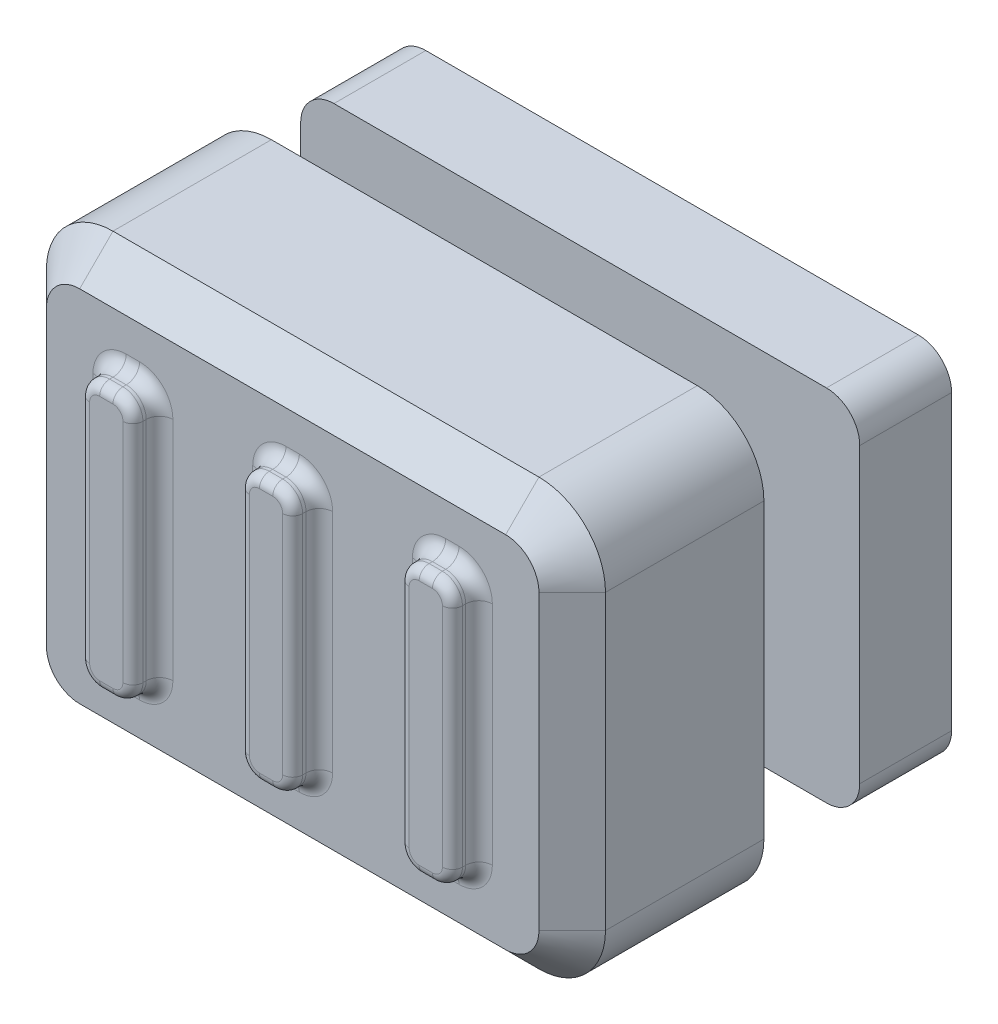
from build123d import *

# Parameters (mm, degrees)
SLIDER_STEM_DEPTH         = 4.2
CAPTIVE_FLANGE_START      = 1.2
CAPTIVE_FLANGE_DEPTH      = 1.38
THUMB_PAD_START           = 4.02
THUMB_PAD_DEPTH           = 2.38
SWITCH_PIN_SOCKET_START   = 2.3
SWITCH_PIN_SOCKET_DEPTH   = 2.4
PCB_EDGE_RELIEF_START     = 0.6
PCB_EDGE_RELIEF_PROFILE_W = 4
PCB_EDGE_RELIEF_PROFILE_H = 1.05
PCB_EDGE_RELIEF_DEPTH     = 0.7
STEM_SHOULDER_ROUND_R     = 0.2
THUMB_RIB_0_START         = 6.8
THUMB_RIB_0_DEPTH         = 0.5
THUMB_RIB_1_START         = 6.8
THUMB_RIB_1_DEPTH         = 0.5
THUMB_RIB_2_START         = 6.8
THUMB_RIB_2_DEPTH         = 0.5
THUMB_RIB_ROOT_ROUND_R    = 0.2
THUMB_RIB_CROWN_ROUND_R   = 0.15


with BuildPart() as part:
    # Slider_stem_profile → Slider_stem (new body)
    with BuildSketch(Plane.XY):
        with BuildLine():
            Line((-1.5, -1.5), (1.5, -1.5))
            ThreePointArc((1.5, -1.5), (1.782842712, -1.382842712), (1.9, -1.1))
            Line((1.9, -1.1), (1.9, 1.1))
            ThreePointArc((1.9, 1.1), (1.782842712, 1.382842712), (1.5, 1.5))
            Line((1.5, 1.5), (-1.5, 1.5))
            ThreePointArc((-1.5, 1.5), (-1.782842712, 1.382842712), (-1.9, 1.1))
            Line((-1.9, 1.1), (-1.9, -1.1))
            ThreePointArc((-1.9, -1.1), (-1.782842712, -1.382842712), (-1.5, -1.5))
        make_face()
    extrude(amount=SLIDER_STEM_DEPTH)

    # Captive_flange_profile → Captive_flange (add)
    with BuildSketch(Plane.XY.offset(CAPTIVE_FLANGE_START)):
        with BuildLine():
            Line((-3.7, -2.7), (3.7, -2.7))
            ThreePointArc((3.7, -2.7), (4.053553391, -2.553553391), (4.2, -2.2))
            Line((4.2, -2.2), (4.2, 2.2))
            ThreePointArc((4.2, 2.2), (4.053553391, 2.553553391), (3.7, 2.7))
            Line((3.7, 2.7), (-3.7, 2.7))
            ThreePointArc((-3.7, 2.7), (-4.053553391, 2.553553391), (-4.2, 2.2))
            Line((-4.2, 2.2), (-4.2, -2.2))
            ThreePointArc((-4.2, -2.2), (-4.053553391, -2.553553391), (-3.7, -2.7))
        make_face()
    extrude(amount=CAPTIVE_FLANGE_DEPTH)

    # Thumb_pad_profile → Thumb_pad (add)
    with BuildSketch(Plane.XY.offset(THUMB_PAD_START)):
        with BuildLine():
            Line((-3.2, -3.2), (3.2, -3.2))
            ThreePointArc((3.2, -3.2), (3.907106781, -2.907106781), (4.2, -2.2))
            Line((4.2, -2.2), (4.2, 2.2))
            ThreePointArc((4.2, 2.2), (3.907106781, 2.907106781), (3.2, 3.2))
            Line((3.2, 3.2), (-3.2, 3.2))
            ThreePointArc((-3.2, 3.2), (-3.907106781, 2.907106781), (-4.2, 2.2))
            Line((-4.2, 2.2), (-4.2, -2.2))
            ThreePointArc((-4.2, -2.2), (-3.907106781, -2.907106781), (-3.2, -3.2))
        make_face()
    extrude(amount=THUMB_PAD_DEPTH)

    # Thumb_pad_chamfer_sectio for Thumb_pad_c → Thumb_pad_chamfer section 0
    with BuildSketch(Plane.XY.offset(6.4)):
        with BuildLine():
            Line((-3.2, -3.2), (3.2, -3.2))
            # circular arc as an exact rational Bezier (weights 1, cos(half-angle), 1)
            Bezier((3.2, -3.2), (4.2, -3.2), (4.2, -2.2), weights=[1, 0.707106781, 1])
            Line((4.2, -2.2), (4.2, 2.2))
            Bezier((4.2, 2.2), (4.2, 3.2), (3.2, 3.2), weights=[1, 0.707106781, 1])
            Line((3.2, 3.2), (-3.2, 3.2))
            Bezier((-3.2, 3.2), (-4.2, 3.2), (-4.2, 2.2), weights=[1, 0.707106781, 1])
            Line((-4.2, 2.2), (-4.2, -2.2))
            Bezier((-4.2, -2.2), (-4.2, -3.2), (-3.2, -3.2), weights=[1, 0.707106781, 1])
        make_face()
    # Thumb_pad_chamfer_sectio for Thumb_p 2 → Thumb_pad_chamfer section 1
    with BuildSketch(Plane.XY.offset(6.9)):
        with BuildLine():
            Line((-3.2, -2.7), (3.2, -2.7))
            Bezier((3.2, -2.7), (3.7, -2.7), (3.7, -2.2), weights=[1, 0.707106781, 1])
            Line((3.7, -2.2), (3.7, 2.2))
            Bezier((3.7, 2.2), (3.7, 2.7), (3.2, 2.7), weights=[1, 0.707106781, 1])
            Line((3.2, 2.7), (-3.2, 2.7))
            Bezier((-3.2, 2.7), (-3.7, 2.7), (-3.7, 2.2), weights=[1, 0.707106781, 1])
            Line((-3.7, 2.2), (-3.7, -2.2))
            Bezier((-3.7, -2.2), (-3.7, -2.7), (-3.2, -2.7), weights=[1, 0.707106781, 1])
        make_face()
    loft()

    # Switch_pin_socket_profile → Switch_pin_socket (cut)
    with BuildSketch(Plane.XY.offset(SWITCH_PIN_SOCKET_START)):
        with BuildLine():
            Line((-0.725, -0.6), (0.725, -0.6))
            ThreePointArc((0.725, -0.6), (0.795710678, -0.570710678), (0.825, -0.5))
            Line((0.825, -0.5), (0.825, 0.5))
            ThreePointArc((0.825, 0.5), (0.795710678, 0.570710678), (0.725, 0.6))
            Line((0.725, 0.6), (-0.725, 0.6))
            ThreePointArc((-0.725, 0.6), (-0.795710678, 0.570710678), (-0.825, 0.5))
            Line((-0.825, 0.5), (-0.825, -0.5))
            ThreePointArc((-0.825, -0.5), (-0.795710678, -0.570710678), (-0.725, -0.6))
        make_face()
    extrude(amount=-SWITCH_PIN_SOCKET_DEPTH, mode=Mode.SUBTRACT)

    # PCB_edge_relief_profile → PCB_edge_relief (cut)
    with BuildSketch(Plane.XY.offset(PCB_EDGE_RELIEF_START)):
        with Locations((0, 1.075)):
            Rectangle(PCB_EDGE_RELIEF_PROFILE_W, PCB_EDGE_RELIEF_PROFILE_H)
    extrude(amount=-PCB_EDGE_RELIEF_DEPTH, mode=Mode.SUBTRACT)

    # Stem_shoulder_round
    stem_shoulder_round_edges = [part.edges().sort_by_distance(p)[0] for p in [
        (1.782842712, -1.382842712, 1.2),
        (-1.782842712, -1.382842712, 1.2),
        (-1.782842712, 1.382842712, 1.2),
        (1.782842712, 1.382842712, 1.2),
        (1.782842712, -1.382842712, 2.58),
        (-1.782842712, -1.382842712, 2.58),
        (-1.782842712, 1.382842712, 2.58),
        (1.782842712, 1.382842712, 2.58),
        (1.782842712, -1.382842712, 4.02),
        (-1.782842712, -1.382842712, 4.02),
        (-1.782842712, 1.382842712, 4.02),
        (1.782842712, 1.382842712, 4.02),
        (0, 1.5, 1.2),
        (-1.9, 0, 1.2),
        (0, -1.5, 1.2),
        (1.9, 0, 1.2),
        (0, 1.5, 2.58),
        (-1.9, 0, 2.58),
        (0, -1.5, 2.58),
        (1.9, 0, 2.58),
        (0, 1.5, 4.02),
        (-1.9, 0, 4.02),
        (0, -1.5, 4.02),
        (1.9, 0, 4.02),
    ]]
    fillet(stem_shoulder_round_edges, radius=STEM_SHOULDER_ROUND_R)

    # Thumb_rib_0_profile → Thumb_rib_0 (add)
    with BuildSketch(Plane.XY.offset(THUMB_RIB_0_START)):
        with BuildLine():
            Line((-2.5, -2), (-2.3, -2))
            ThreePointArc((-2.3, -2), (-2.087867966, -1.912132034), (-2, -1.7))
            Line((-2, -1.7), (-2, 1.7))
            ThreePointArc((-2, 1.7), (-2.087867966, 1.912132034), (-2.3, 2))
            Line((-2.3, 2), (-2.5, 2))
            ThreePointArc((-2.5, 2), (-2.712132034, 1.912132034), (-2.8, 1.7))
            Line((-2.8, 1.7), (-2.8, -1.7))
            ThreePointArc((-2.8, -1.7), (-2.712132034, -1.912132034), (-2.5, -2))
        make_face()
    extrude(amount=THUMB_RIB_0_DEPTH)

    # Thumb_rib_1_profile → Thumb_rib_1 (add)
    with BuildSketch(Plane.XY.offset(THUMB_RIB_1_START)):
        with BuildLine():
            Line((-0.1, -2), (0.1, -2))
            ThreePointArc((0.1, -2), (0.312132034, -1.912132034), (0.4, -1.7))
            Line((0.4, -1.7), (0.4, 1.7))
            ThreePointArc((0.4, 1.7), (0.312132034, 1.912132034), (0.1, 2))
            Line((0.1, 2), (-0.1, 2))
            ThreePointArc((-0.1, 2), (-0.312132034, 1.912132034), (-0.4, 1.7))
            Line((-0.4, 1.7), (-0.4, -1.7))
            ThreePointArc((-0.4, -1.7), (-0.312132034, -1.912132034), (-0.1, -2))
        make_face()
    extrude(amount=THUMB_RIB_1_DEPTH)

    # Thumb_rib_2_profile → Thumb_rib_2 (add)
    with BuildSketch(Plane.XY.offset(THUMB_RIB_2_START)):
        with BuildLine():
            Line((2.3, -2), (2.5, -2))
            ThreePointArc((2.5, -2), (2.712132034, -1.912132034), (2.8, -1.7))
            Line((2.8, -1.7), (2.8, 1.7))
            ThreePointArc((2.8, 1.7), (2.712132034, 1.912132034), (2.5, 2))
            Line((2.5, 2), (2.3, 2))
            ThreePointArc((2.3, 2), (2.087867966, 1.912132034), (2, 1.7))
            Line((2, 1.7), (2, -1.7))
            ThreePointArc((2, -1.7), (2.087867966, -1.912132034), (2.3, -2))
        make_face()
    extrude(amount=THUMB_RIB_2_DEPTH)

    # Thumb_rib_root_round
    thumb_rib_root_round_edges = [part.edges().sort_by_distance(p)[0] for p in [
        (-0.312132034, -1.912132034, 6.9),
        (0, -2, 6.9),
        (0.312132034, -1.912132034, 6.9),
        (0.312132034, 1.912132034, 6.9),
        (0, 2, 6.9),
        (-0.312132034, 1.912132034, 6.9),
        (2.087867966, -1.912132034, 6.9),
        (2.4, -2, 6.9),
        (2.712132034, -1.912132034, 6.9),
        (2.712132034, 1.912132034, 6.9),
        (2.4, 2, 6.9),
        (2.087867966, 1.912132034, 6.9),
        (-2.712132034, -1.912132034, 6.9),
        (-2.4, -2, 6.9),
        (-2.087867966, -1.912132034, 6.9),
        (-2.087867966, 1.912132034, 6.9),
        (-2.4, 2, 6.9),
        (-2.712132034, 1.912132034, 6.9),
        (0.4, 0, 6.9),
        (-0.4, 0, 6.9),
        (2.8, 0, 6.9),
        (2, 0, 6.9),
        (-2, 0, 6.9),
        (-2.8, 0, 6.9),
    ]]
    fillet(thumb_rib_root_round_edges, radius=THUMB_RIB_ROOT_ROUND_R)

    # Thumb_rib_crown_round
    thumb_rib_crown_round_edges = [part.edges().sort_by_distance(p)[0] for p in [
        (0.4, 0, 7.3),
        (0.312132034, 1.912132034, 7.3),
        (0.312132034, -1.912132034, 7.3),
        (0, 2, 7.3),
        (0, -2, 7.3),
        (-0.312132034, 1.912132034, 7.3),
        (-0.312132034, -1.912132034, 7.3),
        (-0.4, 0, 7.3),
        (2.8, 0, 7.3),
        (2.712132034, 1.912132034, 7.3),
        (2.712132034, -1.912132034, 7.3),
        (2.4, 2, 7.3),
        (2.4, -2, 7.3),
        (2.087867966, 1.912132034, 7.3),
        (2.087867966, -1.912132034, 7.3),
        (2, 0, 7.3),
        (-2, 0, 7.3),
        (-2.087867966, 1.912132034, 7.3),
        (-2.087867966, -1.912132034, 7.3),
        (-2.4, 2, 7.3),
        (-2.4, -2, 7.3),
        (-2.712132034, 1.912132034, 7.3),
        (-2.712132034, -1.912132034, 7.3),
        (-2.8, 0, 7.3),
    ]]
    fillet(thumb_rib_crown_round_edges, radius=THUMB_RIB_CROWN_ROUND_R)


solid = part.part
